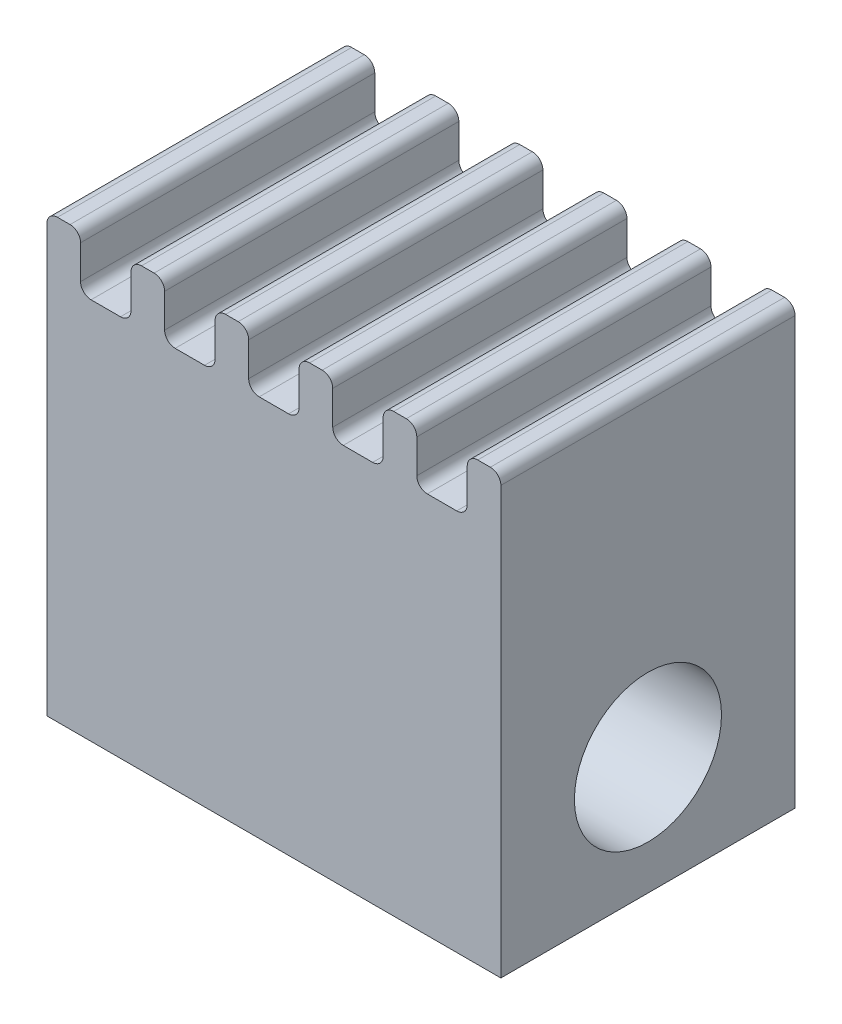
from build123d import *

# Parameters (mm, degrees)
SKETCH_1_W              = 4.5
SKETCH_1_H              = 2.5
SKETCH_1_H_2            = 2
EXTRUDE_1_DEPTH         = 4
EXTRUDE_3_DEPTH         = 26
EXTRUDE_3_DEPTH_BACK    = 26
EXTRUDE_START           = -14
EXTRUDE_4_DEPTH         = 28
EXTRUDE_START_2         = 24.3
EXTRUDE_5_DEPTH         = 1.7
EXTRUDE_START_3         = 12.3
EXTRUDE_6_DEPTH         = 1.7
SKETCH_3_R              = 2
EXTRUDE_7_DEPTH         = 7
FILLET_1_R              = 3
CUT_EXTRUDE_1_REACH     = 42.685
SKETCH_3_4_R            = 2
CUT_EXTRUDE_START       = -24.3
SKETCH_4_R              = 7.5
CUT_EXTRUDE_2_DEPTH     = 24.3
CUT_EXTRUDE_START_2     = -12.3
SKETCH_4_3_R            = 7.5
CUT_EXTRUDE_3_DEPTH     = 12.3
FILLET_2_R              = 3
SKETCH_5_W              = 4.5
SKETCH_5_H              = 1
CUT_EXTRUDE_5_DEPTH     = 52.439284598
CUT_EXTRUDE_START_3     = 18
CUT_EXTRUDE_6_OUTLINE_W = 4.5
CUT_EXTRUDE_6_OUTLINE_H = 1.8
CUT_EXTRUDE_6_DEPTH     = 18
FILLET_3_R              = 2
SKETCH_6_W              = 3
SKETCH_6_H              = 6
CUT_EXTRUDE_7_DEPTH     = 7
SKETCH_7_R              = 1.8
CUT_EXTRUDE_8_DEPTH     = 56.463952257
SKETCH_10_OUTSIDE_W     = 70.182
SKETCH_10_OUTSIDE_H     = 79.182
SKETCH_10_OUTSIDE_W_2   = 10.8
SKETCH_10_OUTSIDE_H_2   = 10.4
CUT_EXTRUDE_11_DEPTH    = 42.560197394
SKETCH_11_W             = 4
SKETCH_11_H             = 10.4
CUT_EXTRUDE_12_DEPTH    = 18.800280897
SKETCH_13_R             = 2
EXTRUDE_8_DEPTH         = 7
SKETCH_14_R             = 1.75
CUT_EXTRUDE_13_DEPTH    = 5


# Read off the part's stored shape, not the designer's step: 凸台-拉伸4, 切除-拉伸6
with BuildPart() as part:
    # 草图1 → 凸台-拉伸1 (new body)
    with BuildSketch(Plane.XY):
        Polygon((26, 30.5), (-26, 30.5), (-26, 12.5), (-26, -3), (-14, -3), (-14, -5.5), (-14, -30.5), (14, -30.5), (14, -5.5), (14, -3), (26, -3), (26, 12.5), align=None)
        with Locations((0, -24.75)):
            Rectangle(SKETCH_1_W, SKETCH_1_H, mode=Mode.SUBTRACT)
        with Locations((0, -4.25)):
            Rectangle(SKETCH_1_W, SKETCH_1_H, mode=Mode.SUBTRACT)
        with Locations((-12.25, 11.5)):
            Rectangle(SKETCH_1_W, SKETCH_1_H_2, mode=Mode.SUBTRACT)
        with Locations((12.25, 11.5)):
            Rectangle(SKETCH_1_W, SKETCH_1_H_2, mode=Mode.SUBTRACT)
    extrude(amount=EXTRUDE_1_DEPTH)

    # 草图2 → 凸台-拉伸3 (add, two sides: drawn at the far end of the back side and taken through both)
    with BuildSketch(Plane(origin=(0, 0, 0), x_dir=(0, 0, -1), z_dir=(1, 0, 0)).offset(-EXTRUDE_3_DEPTH_BACK)):
        with BuildLine():
            Line((0, 30.5), (-10, 30.5))
            ThreePointArc((-10, 30.5), (-1, 21.5), (-10, 12.5))
            Line((-10, 12.5), (0, 12.5))
            Line((0, 12.5), (0, 30.5))
        make_face()
        with BuildLine():
            Line((-10, 14), (-10, 12.5))
            ThreePointArc((-10, 12.5), (-1, 21.5), (-10, 30.5))
            Line((-10, 30.5), (-10, 29))
            ThreePointArc((-10, 29), (-2.5, 21.5), (-10, 14))
        make_face()
    extrude(amount=EXTRUDE_3_DEPTH + EXTRUDE_3_DEPTH_BACK)

    # 凸台-拉伸4 outline → 凸台-拉伸4 (add)
    with BuildSketch(Plane(origin=(0, 0, 0), x_dir=(0, 0, -1), z_dir=(1, 0, 0)).offset(EXTRUDE_START)):
        with BuildLine():
            ThreePointArc((-10, -7), (-6.645898034, -7.791796068), (-4, -10))
            Line((-4, -10), (-4, -5.5))
            Line((-4, -5.5), (-10, -5.5))
            Line((-10, -5.5), (-10, -7))
        make_face()
        with BuildLine():
            Line((-10, -23.5), (-4, -23.5))
            Line((-4, -23.5), (-4, -19))
            ThreePointArc((-4, -19), (-6.645898034, -21.208203932), (-10, -22))
            Line((-10, -22), (-10, -23.5))
        make_face()
    extrude(amount=EXTRUDE_4_DEPTH)

    # 草图2<5> → 凸台-拉伸5 (add)
    with BuildSketch(Plane(origin=(0, 0, 0), x_dir=(0, 0, -1), z_dir=(1, 0, 0)).offset(EXTRUDE_START_2)):
        with BuildLine():
            Line((-10, 16.5), (-10, 14))
            ThreePointArc((-10, 14), (-2.5, 21.5), (-10, 29))
            Line((-10, 29), (-10, 26.5))
            ThreePointArc((-10, 26.5), (-5, 21.5), (-10, 16.5))
        make_face()
    extrude_5 = extrude(amount=EXTRUDE_5_DEPTH)

    # 草图2<6> → 凸台-拉伸6 (add)
    with BuildSketch(Plane(origin=(0, 0, 0), x_dir=(0, 0, -1), z_dir=(1, 0, 0)).offset(EXTRUDE_START_3)):
        with BuildLine():
            Line((-10, -9.5), (-10, -7))
            ThreePointArc((-10, -7), (-2.5, -14.5), (-10, -22))
            Line((-10, -22), (-10, -19.5))
            ThreePointArc((-10, -19.5), (-5, -14.5), (-10, -9.5))
        make_face()
    extrude_6 = extrude(amount=EXTRUDE_6_DEPTH)

    # 镜向1: 凸台-拉伸5, 凸台-拉伸6 across plane
    add(extrude_5.mirror(Plane(origin=(0, 0, 0), x_dir=(0, 0, 1), z_dir=(1, 0, 0))))
    add(extrude_6.mirror(Plane(origin=(0, 0, 0), x_dir=(0, 0, 1), z_dir=(1, 0, 0))))

    # 草图3 → 凸台-拉伸7 (add)
    # profile 1 of 2: a face of its own
    with BuildSketch(Plane.XY.offset(4)):
        with BuildLine():
            Line((-14.5, 8.65), (-14.5, -3))
            Line((-14.5, -3), (26, -3))
            Line((26, -3), (26, 8.65))
            Line((26, 8.65), (15.5, 8.65))
            Line((15.5, 8.65), (15.5, 7.85))
            ThreePointArc((15.5, 7.85), (15.426776695, 7.673223305), (15.25, 7.6))
            Line((15.25, 7.6), (14.55, 7.6))
            ThreePointArc((14.55, 7.6), (14.373223305, 7.673223305), (14.3, 7.85))
            Line((14.3, 7.85), (14.3, 8.65))
            ThreePointArc((14.3, 8.65), (14.226776695, 8.826776695), (14.05, 8.9))
            Line((14.05, 8.9), (13.75, 8.9))
            ThreePointArc((13.75, 8.9), (13.573223305, 8.826776695), (13.5, 8.65))
            Line((13.5, 8.65), (13.5, 7.85))
            ThreePointArc((13.5, 7.85), (13.426776695, 7.673223305), (13.25, 7.6))
            Line((13.25, 7.6), (12.55, 7.6))
            ThreePointArc((12.55, 7.6), (12.373223305, 7.673223305), (12.3, 7.85))
            Line((12.3, 7.85), (12.3, 8.65))
            ThreePointArc((12.3, 8.65), (12.226776695, 8.826776695), (12.05, 8.9))
            Line((12.05, 8.9), (11.75, 8.9))
            ThreePointArc((11.75, 8.9), (11.573223305, 8.826776695), (11.5, 8.65))
            Line((11.5, 8.65), (11.5, 7.85))
            ThreePointArc((11.5, 7.85), (11.426776695, 7.673223305), (11.25, 7.6))
            Line((11.25, 7.6), (10.55, 7.6))
            ThreePointArc((10.55, 7.6), (10.373223305, 7.673223305), (10.3, 7.85))
            Line((10.3, 7.85), (10.3, 8.65))
            ThreePointArc((10.3, 8.65), (10.226776695, 8.826776695), (10.05, 8.9))
            Line((10.05, 8.9), (9.75, 8.9))
            ThreePointArc((9.75, 8.9), (9.573223305, 8.826776695), (9.5, 8.65))
            Line((9.5, 8.65), (9.5, 7.85))
            ThreePointArc((9.5, 7.85), (9.426776695, 7.673223305), (9.25, 7.6))
            Line((9.25, 7.6), (8.55, 7.6))
            ThreePointArc((8.55, 7.6), (8.373223305, 7.673223305), (8.3, 7.85))
            Line((8.3, 7.85), (8.3, 8.65))
            ThreePointArc((8.3, 8.65), (8.226776695, 8.826776695), (8.05, 8.9))
            Line((8.05, 8.9), (7.75, 8.9))
            ThreePointArc((7.75, 8.9), (7.573223305, 8.826776695), (7.5, 8.65))
            Line((7.5, 8.65), (7.5, 7.85))
            ThreePointArc((7.5, 7.85), (7.426776695, 7.673223305), (7.25, 7.6))
            Line((7.25, 7.6), (6.55, 7.6))
            ThreePointArc((6.55, 7.6), (6.373223305, 7.673223305), (6.3, 7.85))
            Line((6.3, 7.85), (6.3, 8.65))
            ThreePointArc((6.3, 8.65), (6.226776695, 8.826776695), (6.05, 8.9))
            Line((6.05, 8.9), (5.75, 8.9))
            ThreePointArc((5.75, 8.9), (5.573223305, 8.826776695), (5.5, 8.65))
            Line((5.5, 8.65), (5.5, 7.85))
            ThreePointArc((5.5, 7.85), (5.426776695, 7.673223305), (5.25, 7.6))
            Line((5.25, 7.6), (4.55, 7.6))
            ThreePointArc((4.55, 7.6), (4.373223305, 7.673223305), (4.3, 7.85))
            Line((4.3, 7.85), (4.3, 8.65))
            ThreePointArc((4.3, 8.65), (4.226776695, 8.826776695), (4.05, 8.9))
            Line((4.05, 8.9), (3.75, 8.9))
            ThreePointArc((3.75, 8.9), (3.573223305, 8.826776695), (3.5, 8.65))
            Line((3.5, 8.65), (3.5, 7.85))
            ThreePointArc((3.5, 7.85), (3.426776695, 7.673223305), (3.25, 7.6))
            Line((3.25, 7.6), (2.55, 7.6))
            ThreePointArc((2.55, 7.6), (2.373223305, 7.673223305), (2.3, 7.85))
            Line((2.3, 7.85), (2.3, 8.65))
            ThreePointArc((2.3, 8.65), (2.226776695, 8.826776695), (2.05, 8.9))
            Line((2.05, 8.9), (1.75, 8.9))
            ThreePointArc((1.75, 8.9), (1.573223305, 8.826776695), (1.5, 8.65))
            Line((1.5, 8.65), (1.5, 7.85))
            ThreePointArc((1.5, 7.85), (1.426776695, 7.673223305), (1.25, 7.6))
            Line((1.25, 7.6), (0.55, 7.6))
            ThreePointArc((0.55, 7.6), (0.373223305, 7.673223305), (0.3, 7.85))
            Line((0.3, 7.85), (0.3, 8.65))
            ThreePointArc((0.3, 8.65), (0.226776695, 8.826776695), (0.05, 8.9))
            Line((0.05, 8.9), (-0.25, 8.9))
            ThreePointArc((-0.25, 8.9), (-0.426776695, 8.826776695), (-0.5, 8.65))
            Line((-0.5, 8.65), (-0.5, 7.85))
            ThreePointArc((-0.5, 7.85), (-0.573223305, 7.673223305), (-0.75, 7.6))
            Line((-0.75, 7.6), (-1.45, 7.6))
            ThreePointArc((-1.45, 7.6), (-1.626776695, 7.673223305), (-1.7, 7.85))
            Line((-1.7, 7.85), (-1.7, 8.65))
            ThreePointArc((-1.7, 8.65), (-1.773223305, 8.826776695), (-1.95, 8.9))
            Line((-1.95, 8.9), (-2.25, 8.9))
            ThreePointArc((-2.25, 8.9), (-2.426776695, 8.826776695), (-2.5, 8.65))
            Line((-2.5, 8.65), (-2.5, 7.85))
            ThreePointArc((-2.5, 7.85), (-2.573223305, 7.673223305), (-2.75, 7.6))
            Line((-2.75, 7.6), (-3.45, 7.6))
            ThreePointArc((-3.45, 7.6), (-3.626776695, 7.673223305), (-3.7, 7.85))
            Line((-3.7, 7.85), (-3.7, 8.65))
            ThreePointArc((-3.7, 8.65), (-3.773223305, 8.826776695), (-3.95, 8.9))
            Line((-3.95, 8.9), (-4.25, 8.9))
            ThreePointArc((-4.25, 8.9), (-4.426776695, 8.826776695), (-4.5, 8.65))
            Line((-4.5, 8.65), (-4.5, 7.85))
            ThreePointArc((-4.5, 7.85), (-4.573223305, 7.673223305), (-4.75, 7.6))
            Line((-4.75, 7.6), (-5.45, 7.6))
            ThreePointArc((-5.45, 7.6), (-5.626776695, 7.673223305), (-5.7, 7.85))
            Line((-5.7, 7.85), (-5.7, 8.65))
            ThreePointArc((-5.7, 8.65), (-5.773223305, 8.826776695), (-5.95, 8.9))
            Line((-5.95, 8.9), (-6.25, 8.9))
            ThreePointArc((-6.25, 8.9), (-6.426776695, 8.826776695), (-6.5, 8.65))
            Line((-6.5, 8.65), (-6.5, 7.85))
            ThreePointArc((-6.5, 7.85), (-6.573223305, 7.673223305), (-6.75, 7.6))
            Line((-6.75, 7.6), (-7.45, 7.6))
            ThreePointArc((-7.45, 7.6), (-7.626776695, 7.673223305), (-7.7, 7.85))
            Line((-7.7, 7.85), (-7.7, 8.65))
            ThreePointArc((-7.7, 8.65), (-7.773223305, 8.826776695), (-7.95, 8.9))
            Line((-7.95, 8.9), (-8.25, 8.9))
            ThreePointArc((-8.25, 8.9), (-8.426776695, 8.826776695), (-8.5, 8.65))
            Line((-8.5, 8.65), (-8.5, 7.85))
            ThreePointArc((-8.5, 7.85), (-8.573223305, 7.673223305), (-8.75, 7.6))
            Line((-8.75, 7.6), (-9.45, 7.6))
            ThreePointArc((-9.45, 7.6), (-9.626776695, 7.673223305), (-9.7, 7.85))
            Line((-9.7, 7.85), (-9.7, 8.65))
            ThreePointArc((-9.7, 8.65), (-9.773223305, 8.826776695), (-9.95, 8.9))
            Line((-9.95, 8.9), (-10.25, 8.9))
            ThreePointArc((-10.25, 8.9), (-10.426776695, 8.826776695), (-10.5, 8.65))
            Line((-10.5, 8.65), (-10.5, 7.85))
            ThreePointArc((-10.5, 7.85), (-10.573223305, 7.673223305), (-10.75, 7.6))
            Line((-10.75, 7.6), (-11.45, 7.6))
            ThreePointArc((-11.45, 7.6), (-11.626776695, 7.673223305), (-11.7, 7.85))
            Line((-11.7, 7.85), (-11.7, 8.65))
            ThreePointArc((-11.7, 8.65), (-11.773223305, 8.826776695), (-11.95, 8.9))
            Line((-11.95, 8.9), (-12.25, 8.9))
            ThreePointArc((-12.25, 8.9), (-12.426776695, 8.826776695), (-12.5, 8.65))
            Line((-12.5, 8.65), (-12.5, 7.85))
            ThreePointArc((-12.5, 7.85), (-12.573223305, 7.673223305), (-12.75, 7.6))
            Line((-12.75, 7.6), (-13.45, 7.6))
            ThreePointArc((-13.45, 7.6), (-13.626776695, 7.673223305), (-13.7, 7.85))
            Line((-13.7, 7.85), (-13.7, 8.65))
            ThreePointArc((-13.7, 8.65), (-13.773223305, 8.826776695), (-13.95, 8.9))
            Line((-13.95, 8.9), (-14.25, 8.9))
            ThreePointArc((-14.25, 8.9), (-14.426776695, 8.826776695), (-14.5, 8.65))
        make_face()
        with Locations((-9.1, 3)):
            Circle(SKETCH_3_R, mode=Mode.SUBTRACT)
    # profile 2 of 2: a face of its own
    with BuildSketch(Plane.XY.offset(4)):
        Polygon((-14.5, 10.5), (-14.5, 9.8), (26, 9.8), (26, 12.5), (14.5, 12.5), (14.5, 10.5), (10, 10.5), (10, 12.5), (-10, 12.5), (-10, 10.5), align=None)
    extrude(amount=EXTRUDE_7_DEPTH)

    # 圆角1
    # the kernel refuses this fillet: 3 mm, written as the material it adds along each edge
    with BuildSketch(Plane(origin=(14, -3, 0), x_dir=(1.4808894851111503e-12, -1.0, 0), z_dir=(0, 0, 1))) as fillet_1_piece_1_section:
        with BuildLine():
            CenterArc((FILLET_1_R, FILLET_1_R), FILLET_1_R, 180, 90)
            Line((0, FILLET_1_R), (0, 0))
            Line((0, 0), (FILLET_1_R, 0))
        make_face()
    fillet_1_piece_1 = extrude(amount=4, mode=Mode.PRIVATE)
    fillet_1_piece_1 = split(fillet_1_piece_1, bisect_by=Plane(origin=(13.978029732, -5.5, 2), z_dir=(0, -1, 0)), keep=Keep.TOP, mode=Mode.PRIVATE)
    add(fillet_1_piece_1)
    with BuildSketch(Plane(origin=(14, -3, 0), x_dir=(1.4808894851111503e-12, -1.0, 0), z_dir=(0, 0, 1))) as fillet_1_piece_2_section:
        with BuildLine():
            CenterArc((FILLET_1_R, FILLET_1_R), FILLET_1_R, 180, 90)
            Line((0, FILLET_1_R), (0, 0))
            Line((0, 0), (FILLET_1_R, 0))
        make_face()
    fillet_1_piece_2 = extrude(amount=4, mode=Mode.PRIVATE)
    fillet_1_piece_2 = split(fillet_1_piece_2, bisect_by=Plane(origin=(14.690666213, -5.5, 2), z_dir=(0, 1, 0)), keep=Keep.TOP, mode=Mode.PRIVATE)
    add(fillet_1_piece_2)
    with BuildSketch(Plane(origin=(14, -3, 0), x_dir=(1.4808894851111503e-12, -1.0, 0), z_dir=(0, 0, 1))) as fillet_1_piece_3_section:
        with BuildLine():
            CenterArc((FILLET_1_R, FILLET_1_R), FILLET_1_R, 180, 90)
            Line((0, FILLET_1_R), (0, 0))
            Line((0, 0), (FILLET_1_R, 0))
        make_face()
    fillet_1_piece_3 = extrude(amount=11.5, mode=Mode.PRIVATE)
    fillet_1_piece_3 = split(fillet_1_piece_3, bisect_by=Plane(origin=(13.978029732, -5.726390424, 10), z_dir=(0, 0, -1)), keep=Keep.TOP, mode=Mode.PRIVATE)
    fillet_1_piece_3 = split(fillet_1_piece_3, bisect_by=Plane(origin=(13.978029732, -5.5, 7), z_dir=(0, -1, 0)), keep=Keep.TOP, mode=Mode.PRIVATE)
    fillet_1_piece_3 = split(fillet_1_piece_3, bisect_by=Plane(origin=(13.978029732, -5.726390424, 4), z_dir=(0, 0, 1)), keep=Keep.TOP, mode=Mode.PRIVATE)
    add(fillet_1_piece_3)
    with BuildSketch(Plane(origin=(-14, -3, 0), x_dir=(1.4305593746657148e-12, -1.0, 0), z_dir=(0, 0, 1))) as fillet_1_piece_4_section:
        with BuildLine():
            CenterArc((FILLET_1_R, -FILLET_1_R), FILLET_1_R, 90, 90)
            Line((0, -FILLET_1_R), (0, 0))
            Line((0, 0), (FILLET_1_R, 0))
        make_face()
    fillet_1_piece_4 = extrude(amount=4, mode=Mode.PRIVATE)
    fillet_1_piece_4 = split(fillet_1_piece_4, bisect_by=Plane(origin=(-13.978029732, -5.5, 2), z_dir=(0, -1, 0)), keep=Keep.TOP, mode=Mode.PRIVATE)
    add(fillet_1_piece_4)
    with BuildSketch(Plane(origin=(-14, -3, 0), x_dir=(1.4305593746657148e-12, -1.0, 0), z_dir=(0, 0, 1))) as fillet_1_piece_5_section:
        with BuildLine():
            CenterArc((FILLET_1_R, -FILLET_1_R), FILLET_1_R, 90, 90)
            Line((0, -FILLET_1_R), (0, 0))
            Line((0, 0), (FILLET_1_R, 0))
        make_face()
    fillet_1_piece_5 = extrude(amount=4, mode=Mode.PRIVATE)
    fillet_1_piece_5 = split(fillet_1_piece_5, bisect_by=Plane(origin=(-14.188378362, -5.5, 2), z_dir=(0, 1, 0)), keep=Keep.TOP, mode=Mode.PRIVATE)
    fillet_1_piece_5 = split(fillet_1_piece_5, bisect_by=Plane(origin=(-14.5, -3.973372494, 2), z_dir=(1, 0, 0)), keep=Keep.TOP, mode=Mode.PRIVATE)
    add(fillet_1_piece_5)
    with BuildSketch(Plane(origin=(-14, -3, 0), x_dir=(1.4305593746657148e-12, -1.0, 0), z_dir=(0, 0, 1))) as fillet_1_piece_6_section:
        with BuildLine():
            CenterArc((FILLET_1_R, -FILLET_1_R), FILLET_1_R, 90, 90)
            Line((0, -FILLET_1_R), (0, 0))
            Line((0, 0), (FILLET_1_R, 0))
        make_face()
    fillet_1_piece_6 = extrude(amount=11.5, mode=Mode.PRIVATE)
    fillet_1_piece_6 = split(fillet_1_piece_6, bisect_by=Plane(origin=(-13.978029732, -5.726390424, 10), z_dir=(0, 0, -1)), keep=Keep.TOP, mode=Mode.PRIVATE)
    fillet_1_piece_6 = split(fillet_1_piece_6, bisect_by=Plane(origin=(-13.978029732, -5.726390424, 4), z_dir=(0, 0, 1)), keep=Keep.TOP, mode=Mode.PRIVATE)
    fillet_1_piece_6 = split(fillet_1_piece_6, bisect_by=Plane(origin=(-13.978029732, -5.5, 7), z_dir=(0, -1, 0)), keep=Keep.TOP, mode=Mode.PRIVATE)
    add(fillet_1_piece_6)
    with BuildSketch(Plane(origin=(-14, -3, 0), x_dir=(1.4305593746657148e-12, -1.0, 0), z_dir=(0, 0, 1))) as fillet_1_piece_7_section:
        with BuildLine():
            CenterArc((FILLET_1_R, -FILLET_1_R), FILLET_1_R, 90, 90)
            Line((0, -FILLET_1_R), (0, 0))
            Line((0, 0), (FILLET_1_R, 0))
        make_face()
    fillet_1_piece_7 = extrude(amount=4, mode=Mode.PRIVATE)
    fillet_1_piece_7 = split(fillet_1_piece_7, bisect_by=Plane(origin=(-14.5, -3.326599677, 2), z_dir=(-1, 0, 0)), keep=Keep.TOP, mode=Mode.PRIVATE)
    add(fillet_1_piece_7)
    # the kernel refuses this fillet: 3 mm, written as the material it takes off along each edge
    with BuildSketch(Plane(origin=(14, -30.5, -7.5), x_dir=(0, 1, 0), z_dir=(0, 0, 1)), Plane(origin=(-14, -30.5, -7.5), x_dir=(1, 0, 0), z_dir=(0, 0, 1)), Plane(origin=(-26, -3, -7.5), x_dir=(1, 0, 0), z_dir=(0, 0, 1))) as fillet_1_2_piece_1:
        with BuildLine():
            CenterArc((FILLET_1_R, FILLET_1_R), FILLET_1_R, 180, 90)
            Line((0, FILLET_1_R), (0, 0))
            Line((0, 0), (FILLET_1_R, 0))
        make_face()
    extrude(amount=19, mode=Mode.SUBTRACT)
    with BuildSketch(Plane(origin=(26, -3, 18.5), x_dir=(-1, 0, 0), z_dir=(0, 0, -1))) as fillet_1_2_piece_2:
        with BuildLine():
            CenterArc((FILLET_1_R, FILLET_1_R), FILLET_1_R, 180, 90)
            Line((0, FILLET_1_R), (0, 0))
            Line((0, 0), (FILLET_1_R, 0))
        make_face()
    extrude(amount=26, mode=Mode.SUBTRACT)

    # 草图3<4> → 切除-拉伸1 (cut, up to next)
    with BuildSketch(Plane.XY.offset(4), mode=Mode.PRIVATE) as cut_extrude_1_sk1:
        with Locations((-8, -27)):
            Circle(SKETCH_3_4_R)
    cut_extrude_1_tool1 = extrude(cut_extrude_1_sk1.sketch, amount=-CUT_EXTRUDE_1_REACH, mode=Mode.PRIVATE) & part.part
    # 草图3<4> → 切除-拉伸1 (cut, up to next)
    with BuildSketch(Plane.XY.offset(4), mode=Mode.PRIVATE) as cut_extrude_1_sk2:
        with Locations((8, -27)):
            Circle(SKETCH_3_4_R)
    cut_extrude_1_tool2 = extrude(cut_extrude_1_sk2.sketch, amount=-CUT_EXTRUDE_1_REACH, mode=Mode.PRIVATE) & part.part
    # 草图3<4> → 切除-拉伸1 (cut, up to next)
    with BuildSketch(Plane.XY.offset(4), mode=Mode.PRIVATE) as cut_extrude_1_sk3:
        with Locations((-9.1, 3)):
            Circle(SKETCH_3_4_R)
    cut_extrude_1_tool3 = extrude(cut_extrude_1_sk3.sketch, amount=-CUT_EXTRUDE_1_REACH, mode=Mode.PRIVATE) & part.part
    add(cut_extrude_1_tool1.solids().sort_by_distance((-8, -27, 4))[0], mode=Mode.SUBTRACT)
    add(cut_extrude_1_tool2.solids().sort_by_distance((8, -27, 4))[0], mode=Mode.SUBTRACT)
    add(cut_extrude_1_tool3.solids().sort_by_distance((-9.1, 3, 4))[0], mode=Mode.SUBTRACT)

    # 草图4 → 切除-拉伸2 (cut)
    with BuildSketch(Plane(origin=(0, 0, 0), x_dir=(0, 0, -1), z_dir=(1, 0, 0)).offset(CUT_EXTRUDE_START)):
        with Locations((-10, 21.5)):
            Circle(SKETCH_4_R)
    cut_extrude_2 = extrude(amount=CUT_EXTRUDE_2_DEPTH, mode=Mode.SUBTRACT)

    # 草图4<3> → 切除-拉伸3 (cut)
    with BuildSketch(Plane(origin=(0, 0, 0), x_dir=(0, 0, -1), z_dir=(1, 0, 0)).offset(CUT_EXTRUDE_START_2)):
        with Locations((-10, -14.5)):
            Circle(SKETCH_4_3_R)
    cut_extrude_3 = extrude(amount=CUT_EXTRUDE_3_DEPTH, mode=Mode.SUBTRACT)

    # 镜向2: 切除-拉伸2, 切除-拉伸3 across plane
    add(cut_extrude_2.mirror(Plane(origin=(0, 0, 0), x_dir=(0, 0, 1), z_dir=(1, 0, 0))), mode=Mode.SUBTRACT)
    add(cut_extrude_3.mirror(Plane(origin=(0, 0, 0), x_dir=(0, 0, 1), z_dir=(1, 0, 0))), mode=Mode.SUBTRACT)

    # 圆角2
    fillet_2_edges = [part.edges().sort_by_distance(p)[0] for p in [
        (0, 30.5, 0),
    ]]
    fillet(fillet_2_edges, radius=FILLET_2_R)

    # 草图5 → 切除-拉伸5 (cut, through all)
    with BuildSketch(Plane.XZ.offset(-12.5)):
        with Locations((-12.25, 0.5)):
            Rectangle(SKETCH_5_W, SKETCH_5_H)
        with Locations((12.25, 0.5)):
            Rectangle(SKETCH_5_W, SKETCH_5_H)
    extrude(amount=-CUT_EXTRUDE_5_DEPTH, mode=Mode.SUBTRACT)

    # 切除-拉伸6 outline → 切除-拉伸6 (cut)
    with BuildSketch(Plane.XZ.offset(-12.5).offset(CUT_EXTRUDE_START_3)):
        with Locations((0, 0.9)):
            Rectangle(CUT_EXTRUDE_6_OUTLINE_W, CUT_EXTRUDE_6_OUTLINE_H)
    extrude(amount=CUT_EXTRUDE_6_DEPTH, mode=Mode.SUBTRACT)

    # 圆角3
    fillet_3_edges = [part.edges().sort_by_distance(p)[0] for p in [
        (-12.25, 12.5, 1),
        (12.25, 12.5, 1),
        (0, -23.5, 1.8),
        (0, -5.5, 1.8),
    ]]
    fillet(fillet_3_edges, radius=FILLET_3_R)

    # 草图6 → 切除-拉伸7 (cut)
    with BuildSketch(Plane.XY.offset(11)):
        Polygon((26, 5.5), (19, 5.5), (19, -1.5), (-3.7, -1.5), (-3.7, 9.8), (26, 9.8), align=None)
        with Locations((22.5, 1.5)):
            Rectangle(SKETCH_6_W, SKETCH_6_H)
    extrude(amount=-CUT_EXTRUDE_7_DEPTH, mode=Mode.SUBTRACT)

    # 草图7 → 切除-拉伸8 (cut, through all)
    with BuildSketch(Plane.ZY.offset(-19)):
        with Locations(Location((7.5, 1.5, 0), (0, 0, 303.557309762))):
            Circle(SKETCH_7_R)
    extrude(amount=-CUT_EXTRUDE_8_DEPTH, mode=Mode.SUBTRACT)

    # 草图10 outside → 切除-拉伸11 (cut, through all)
    with BuildSketch(Plane.XY.offset(11)):
        Rectangle(SKETCH_10_OUTSIDE_W, SKETCH_10_OUTSIDE_H)
        with Locations((-9.1, 3.7)):
            Rectangle(SKETCH_10_OUTSIDE_W_2, SKETCH_10_OUTSIDE_H_2, mode=Mode.SUBTRACT)
    extrude(amount=-CUT_EXTRUDE_11_DEPTH, mode=Mode.SUBTRACT)

    # 草图11 → 切除-拉伸12 (cut, through all)
    with BuildSketch(Plane(origin=(-3.7, 0, 0), x_dir=(0, 0, -1), z_dir=(1, 0, 0))):
        with Locations((-2, 3.7)):
            Rectangle(SKETCH_11_W, SKETCH_11_H)
    extrude(amount=-CUT_EXTRUDE_12_DEPTH, mode=Mode.SUBTRACT)

    # 草图13 → 凸台-拉伸8 (add)
    with BuildSketch(Plane(origin=(0, 0, 4), x_dir=(-1, 0, 0), z_dir=(0, 0, -1))):
        with Locations((9.1, 3)):
            Circle(SKETCH_13_R)
    extrude(amount=-EXTRUDE_8_DEPTH)

    # 草图14 → 切除-拉伸13 (cut)
    with BuildSketch(Plane(origin=(-3.7, 0, 0), x_dir=(0, 0, -1), z_dir=(1, 0, 0))):
        with Locations((-7.5, 1.3)):
            Circle(SKETCH_14_R)
    extrude(amount=-CUT_EXTRUDE_13_DEPTH, mode=Mode.SUBTRACT)


solid = part.part
